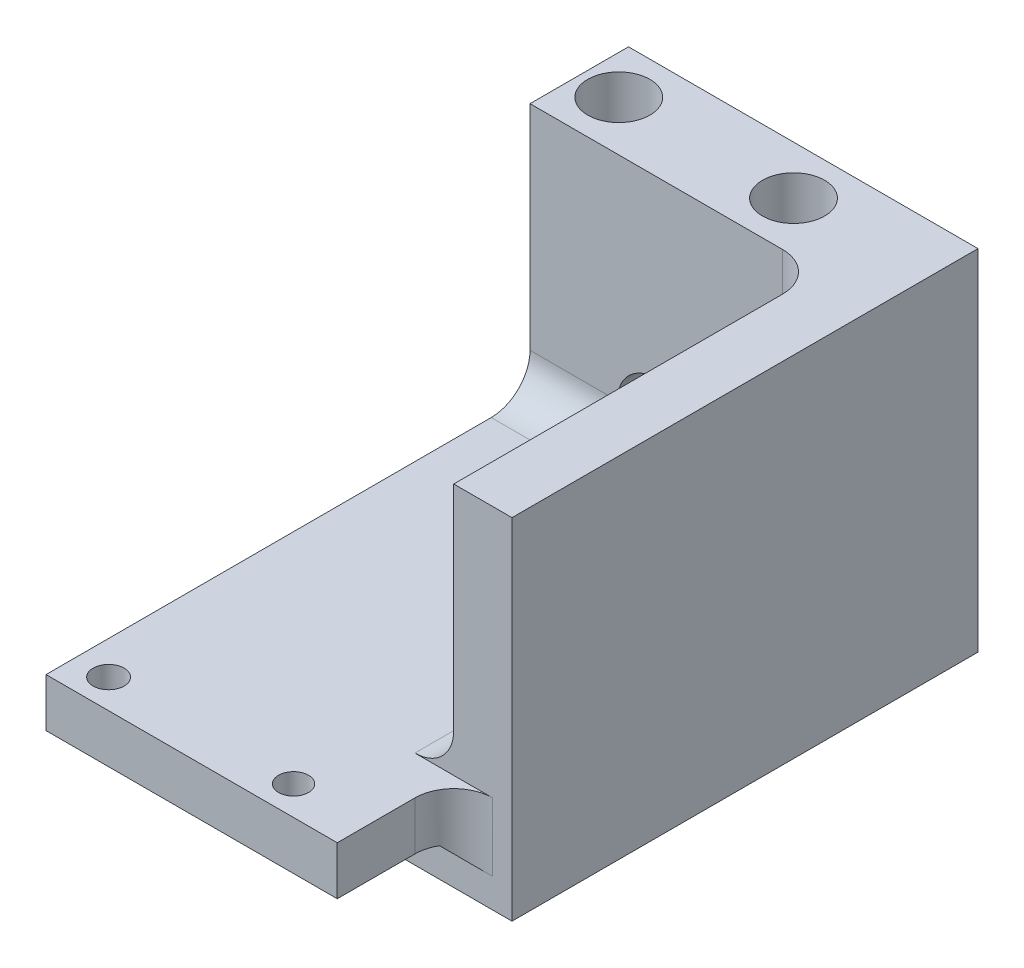
from build123d import *

# Parameters (mm, degrees)
SKETCH2_W           = 30
SKETCH2_H           = 60
SKETCH2_R           = 1.6
SKETCH2_R_2         = 1.544536525
BOSS_EXTRUDE1_DEPTH = 36
SKETCH3_W           = 30
SKETCH3_H           = 49.856005965
CUT_EXTRUDE1_DEPTH  = 26
SKETCH4_W           = 30
SKETCH4_H           = 12
CUT_EXTRUDE2_DEPTH  = 5
SKETCH5_R           = 3.2
CUT_EXTRUDE3_DEPTH  = 26
SKETCH6_R           = 4
CUT_EXTRUDE4_DEPTH  = 26
SKETCH8_W           = 48
SKETCH8_H           = 36
BOSS_EXTRUDE3_DEPTH = 6
CHAMFER1_SIZE       = 2
FILLET1_R           = 4
FILLET2_R           = 4


with BuildPart() as part:
    # Sketch2 → Boss-Extrude1 (new body)
    with BuildSketch(Plane(origin=(0, 0, 0), x_dir=(1, 0, 0), z_dir=(0, 1, 0))):
        with Locations((15, 30)):
            Rectangle(SKETCH2_W, SKETCH2_H)
        with Locations(Location((3.45, 3, 0), (0, 0, 270))):
            Circle(SKETCH2_R, mode=Mode.SUBTRACT)
        with Locations(Location((22.5, 3, 0), (0, 0, 270))):
            Circle(SKETCH2_R_2, mode=Mode.SUBTRACT)
        with Locations(Location((4, 55, 0), (0, 0, 270))):
            Circle(SKETCH2_R, mode=Mode.SUBTRACT)
        with Locations(Location((22, 55, 0), (0, 0, 270))):
            Circle(SKETCH2_R, mode=Mode.SUBTRACT)
    extrude(amount=BOSS_EXTRUDE1_DEPTH)

    # Sketch3 → Cut-Extrude1 (cut)
    with BuildSketch(Plane(origin=(0, 36, 0), x_dir=(1, 0, 0), z_dir=(0, 1, 0))):
        with Locations((15, 24.928002983)):
            Rectangle(SKETCH3_W, SKETCH3_H)
    extrude(amount=-CUT_EXTRUDE1_DEPTH, mode=Mode.SUBTRACT)

    # Sketch4 → Cut-Extrude2 (cut)
    with BuildSketch(Plane.XZ):
        with Locations((15, -6)):
            Rectangle(SKETCH4_W, SKETCH4_H)
    extrude(amount=-CUT_EXTRUDE2_DEPTH, mode=Mode.SUBTRACT)

    # Sketch5 → Cut-Extrude3 (cut)
    with BuildSketch(Plane(origin=(0, 36, 0), x_dir=(1, 0, 0), z_dir=(0, 1, 0))):
        with Locations(Location((4, 55, 0), (0, 0, 270))):
            Circle(SKETCH5_R)
        with Locations(Location((22, 55, 0), (0, 0, 270))):
            Circle(SKETCH5_R)
    extrude(amount=-CUT_EXTRUDE3_DEPTH, mode=Mode.SUBTRACT)

    # Sketch6 → Cut-Extrude4 (cut)
    with BuildSketch(Plane(origin=(0, 0, -60), x_dir=(-1, 0, 0), z_dir=(0, 0, -1))):
        with Locations((-13, 14)):
            Circle(SKETCH6_R)
    extrude(amount=-CUT_EXTRUDE4_DEPTH, mode=Mode.SUBTRACT)

    # Sketch8 → Boss-Extrude3 (add)
    with BuildSketch(Plane(origin=(30, 0, 0), x_dir=(0, 0, -1), z_dir=(1, 0, 0))):
        with Locations((36, 18)):
            Rectangle(SKETCH8_W, SKETCH8_H)
    extrude(amount=BOSS_EXTRUDE3_DEPTH)

    # Chamfer1
    chamfer1_edges = [part.edges().sort_by_distance(p)[0] for p in [
        (15, 5, -12),
    ]]
    chamfer(chamfer1_edges, length=CHAMFER1_SIZE)

    # Fillet1
    # the kernel refuses this fillet: 4 mm, written as the material it adds along each edge
    with BuildSketch(Plane(origin=(30, 10, -12), x_dir=(0, 0, 1), z_dir=(0, -1, 0))) as fillet1_piece_1_section:
        with BuildLine():
            CenterArc((FILLET1_R, -FILLET1_R), FILLET1_R, 90, 90)
            Line((0, -FILLET1_R), (0, 0))
            Line((0, 0), (FILLET1_R, 0))
        make_face()
    fillet1_piece_1 = extrude(amount=17, mode=Mode.PRIVATE)
    fillet1_piece_1 = split(fillet1_piece_1, bisect_by=Plane(origin=(30.901414649, 5.69775692, -9.30224308), z_dir=(0, 0.7071067811865476, -0.7071067811865476)), keep=Keep.TOP, mode=Mode.PRIVATE)
    add(fillet1_piece_1)
    with BuildSketch(Plane(origin=(30, 20, -12), x_dir=(0, 0, 1), z_dir=(0, -1, 0))) as fillet1_piece_2_section:
        with BuildLine():
            CenterArc((FILLET1_R, -FILLET1_R), FILLET1_R, 90, 90)
            Line((0, -FILLET1_R), (0, 0))
            Line((0, 0), (FILLET1_R, 0))
        make_face()
    fillet1_piece_2 = extrude(amount=27, mode=Mode.PRIVATE)
    fillet1_piece_2 = split(fillet1_piece_2, bisect_by=Plane(origin=(30.104627362, 5, -9.206224594), z_dir=(0, 1, 0)), keep=Keep.TOP, mode=Mode.PRIVATE)
    fillet1_piece_2 = split(fillet1_piece_2, bisect_by=Plane(origin=(30.104627362, 5.595331555, -9.404668445), z_dir=(0, -0.7071067811865476, 0.7071067811865476)), keep=Keep.TOP, mode=Mode.PRIVATE)
    add(fillet1_piece_2)

    # Fillet2
    # the kernel refuses this fillet: 4 mm, written as the material it adds along each edge
    with BuildSketch(Plane(origin=(26, 14, -45.856005965), x_dir=(0, 0, -1), z_dir=(0, -1, 0))) as fillet2_piece_1_section:
        Polygon((0, 0), (FILLET2_R * 1.02, 0), (FILLET2_R * 1.02, FILLET2_R * 1.02), (0, FILLET2_R * 1.02), align=None)
    fillet2_piece_1 = extrude(amount=FILLET2_R * 1.02, mode=Mode.PRIVATE)
    fillet2_piece_1 = fillet2_piece_1 - Plane(origin=(26, 14, -45.856005965), x_dir=(-0.7071067811865475, 0, 0.7071067811865475), z_dir=(0, -1, 0)) * Sphere(FILLET2_R, mode=Mode.PRIVATE)
    add(fillet2_piece_1)
    with BuildSketch(Plane(origin=(26, 10, -49.856005965), x_dir=(0, 1, 0), z_dir=(-1, 0, 0))) as fillet2_piece_2_section:
        with BuildLine():
            CenterArc((FILLET2_R, -FILLET2_R), FILLET2_R, 90, 90)
            Line((0, -FILLET2_R), (0, 0))
            Line((0, 0), (FILLET2_R, 0))
        make_face()
    fillet2_piece_2 = extrude(amount=13, mode=Mode.PRIVATE)
    fillet2_piece_2 = fillet2_piece_2 - Plane(origin=(13, 14, -48.921311945), x_dir=(-1, 0, 0), z_dir=(0, 0, -1)) * Cylinder(4, 42, mode=Mode.PRIVATE)
    add(fillet2_piece_2)
    with BuildSketch(Plane(origin=(30, 36, -49.856005965), x_dir=(-1, 0, 0), z_dir=(0, -1, 0))) as fillet2_piece_3:
        with BuildLine():
            CenterArc((FILLET2_R, -FILLET2_R), FILLET2_R, 90, 90)
            Line((0, -FILLET2_R), (0, 0))
            Line((0, 0), (FILLET2_R, 0))
        make_face()
    extrude(amount=22)
    with BuildSketch(Plane(origin=(13, 10, -49.856005965), x_dir=(0, 1, 0), z_dir=(-1, 0, 0))) as fillet2_piece_4_section:
        with BuildLine():
            CenterArc((FILLET2_R, -FILLET2_R), FILLET2_R, 90, 90)
            Line((0, -FILLET2_R), (0, 0))
            Line((0, 0), (FILLET2_R, 0))
        make_face()
    fillet2_piece_4 = extrude(amount=13, mode=Mode.PRIVATE)
    fillet2_piece_4 = fillet2_piece_4 - Plane(origin=(13, 14, -48.921311944), x_dir=(-1, 0, 0), z_dir=(0, 0, -1)) * Cylinder(4, 43, mode=Mode.PRIVATE)
    add(fillet2_piece_4)
    with BuildSketch(Plane(origin=(30, 10, -12), x_dir=(0, 1, 0), z_dir=(0, 0, -1))) as fillet2_piece_5:
        with BuildLine():
            CenterArc((FILLET2_R, -FILLET2_R), FILLET2_R, 90, 90)
            Line((0, -FILLET2_R), (0, 0))
            Line((0, 0), (FILLET2_R, 0))
        make_face()
    extrude(amount=33.856005965)


solid = part.part
